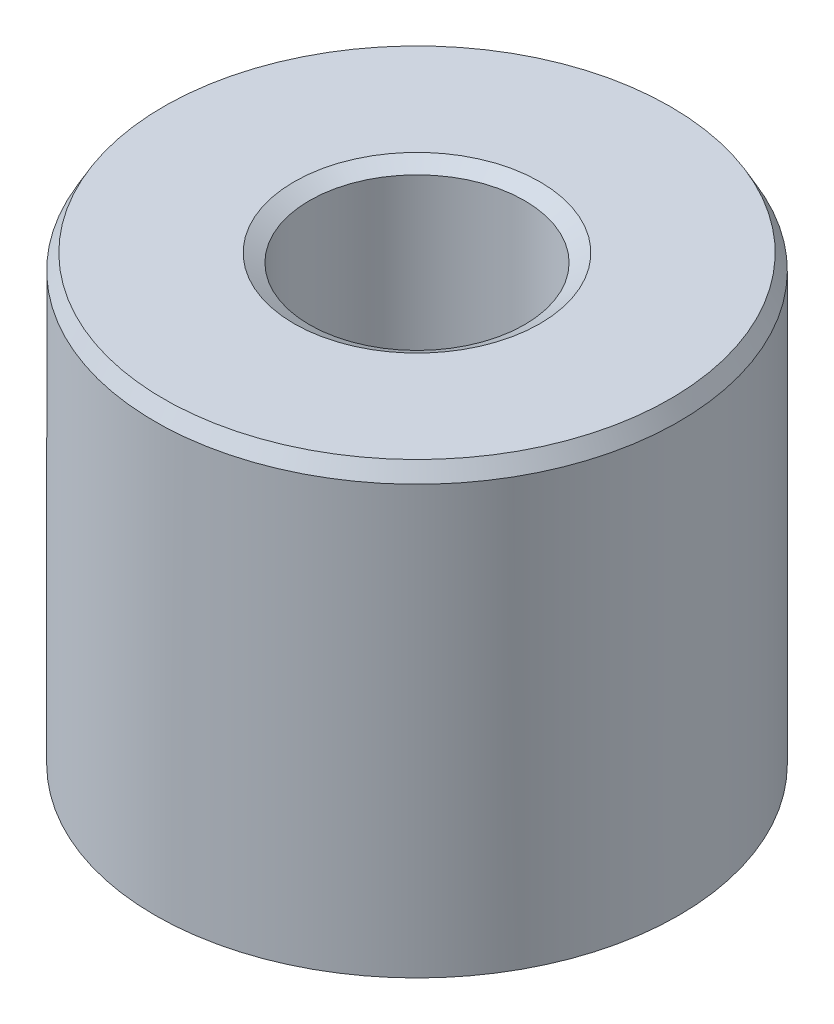
from build123d import *
from OCP.BRepFilletAPI import BRepFilletAPI_MakeChamfer

# Parameters (mm, degrees)
SKETCH1_R           = 7.5
BOSS_EXTRUDE1_DEPTH = 12.931380334
SKETCH2_R           = 3.080896029
CUT_EXTRUDE1_DEPTH  = 17.724849696
CHAMFER1_SIZE       = 0.440174546
CHAMFER1_SIZE2      = 0.245773307


with BuildPart() as part:
    # Sketch1 → Boss-Extrude1 (new body)
    with BuildSketch(Plane(origin=(0, 0, 0), x_dir=(1, 0, 0), z_dir=(0, 1, 0))):
        Circle(SKETCH1_R)
    extrude(amount=BOSS_EXTRUDE1_DEPTH)

    # Sketch2 → Cut-Extrude1 (cut, through all)
    with BuildSketch(Plane(origin=(0, 0, 0), x_dir=(1, 0, 0), z_dir=(0, 1, 0))):
        Circle(SKETCH2_R)
    extrude(amount=CUT_EXTRUDE1_DEPTH, mode=Mode.SUBTRACT)

    # Chamfer1: one chamfer whose edges measure the first distance from different faces: ONE call of the kernel's chamfer builder (chamfer() names one face for all edges)
    chamfer1_edges_1 = [part.edges().sort_by_distance(p)[0] for p in [
        (-3.080896029, 12.931380334, 0),
    ]]
    chamfer1_side_1 = [part.faces().sort_by_distance(p)[0] for p in [
        (-7.287867966, 12.931380334, 0),
    ]]
    chamfer1_edges_2 = [part.edges().sort_by_distance(p)[0] for p in [
        (-3.080896029, 0, 0),
    ]]
    chamfer1_side_2 = [part.faces().sort_by_distance(p)[0] for p in [
        (-3.080896029, 6.465690167, 0),
    ]]
    chamfer1_edges_3 = [part.edges().sort_by_distance(p)[0] for p in [
        (-7.5, 0, 0),
    ]]
    chamfer1_side_3 = [part.faces().sort_by_distance(p)[0] for p in [
        (-7.287867966, 0, 0),
    ]]
    chamfer1_edges_4 = [part.edges().sort_by_distance(p)[0] for p in [
        (-7.5, 12.931380334, 0),
    ]]
    chamfer1_side_4 = [part.faces().sort_by_distance(p)[0] for p in [
        (-7.5, 6.465690167, 0),
    ]]
    chamfer1 = BRepFilletAPI_MakeChamfer(part.part.solid().wrapped)
    for e in chamfer1_edges_1:
        chamfer1.Add(CHAMFER1_SIZE, CHAMFER1_SIZE2, e.wrapped, chamfer1_side_1[0].wrapped)  # the first distance lies on this face
    for e in chamfer1_edges_2:
        chamfer1.Add(CHAMFER1_SIZE, CHAMFER1_SIZE2, e.wrapped, chamfer1_side_2[0].wrapped)  # the first distance lies on this face
    for e in chamfer1_edges_3:
        chamfer1.Add(CHAMFER1_SIZE, CHAMFER1_SIZE2, e.wrapped, chamfer1_side_3[0].wrapped)  # the first distance lies on this face
    for e in chamfer1_edges_4:
        chamfer1.Add(CHAMFER1_SIZE, CHAMFER1_SIZE2, e.wrapped, chamfer1_side_4[0].wrapped)  # the first distance lies on this face
    add(Compound.cast(chamfer1.Shape()), mode=Mode.REPLACE)


solid = part.part
